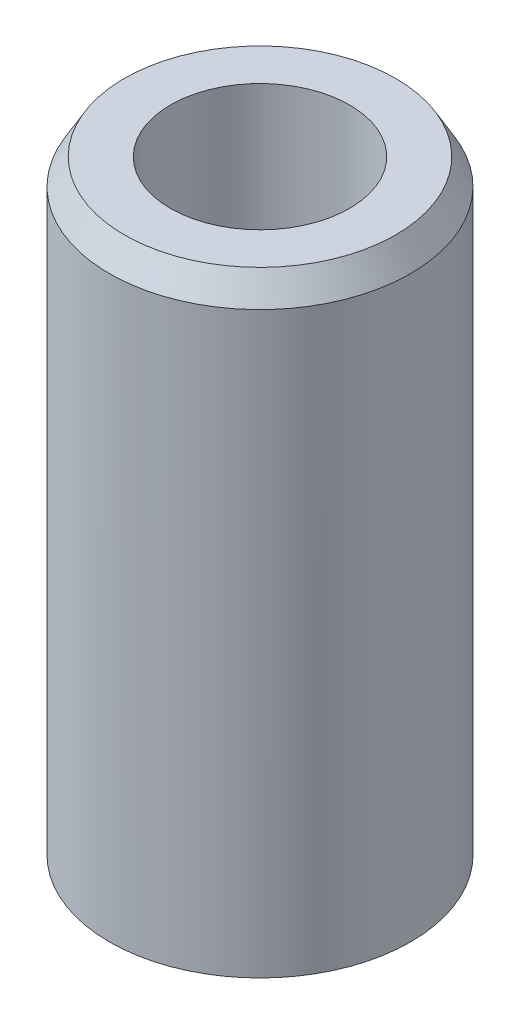
from build123d import *
from OCP.BRepFilletAPI import BRepFilletAPI_MakeChamfer

# Parameters (mm, degrees)
SKETCH1_R           = 22.5
BOSS_EXTRUDE1_DEPTH = 92.588702035
SKETCH2_R           = 13.387813407
CUT_EXTRUDE1_DEPTH  = 98.903869916
CHAMFER1_SIZE       = 3.880772922
CHAMFER1_SIZE2      = 2.240565291


with BuildPart() as part:
    # Sketch1 → Boss-Extrude1 (new body)
    with BuildSketch(Plane(origin=(0, 0, 0), x_dir=(1, 0, 0), z_dir=(0, 1, 0))):
        Circle(SKETCH1_R)
    extrude(amount=BOSS_EXTRUDE1_DEPTH)

    # Sketch2 → Cut-Extrude1 (cut, through all)
    with BuildSketch(Plane(origin=(0, 0, 0), x_dir=(1, 0, 0), z_dir=(0, 1, 0))):
        Circle(SKETCH2_R)
    extrude(amount=CUT_EXTRUDE1_DEPTH, mode=Mode.SUBTRACT)

    # Chamfer1: one chamfer whose edges measure the first distance from different faces: ONE call of the kernel's chamfer builder (chamfer() names one face for all edges)
    chamfer1_edges_1 = [part.edges().sort_by_distance(p)[0] for p in [
        (-22.5, 92.588702035, 0),
    ]]
    chamfer1_side_1 = [part.faces().sort_by_distance(p)[0] for p in [
        (-22.5, 46.294351017, 0),
    ]]
    chamfer1_edges_2 = [part.edges().sort_by_distance(p)[0] for p in [
        (-22.5, 0, 0),
    ]]
    chamfer1_side_2 = [part.faces().sort_by_distance(p)[0] for p in [
        (-21.863603897, 0, 0),
    ]]
    chamfer1 = BRepFilletAPI_MakeChamfer(part.part.solid().wrapped)
    for e in chamfer1_edges_1:
        chamfer1.Add(CHAMFER1_SIZE, CHAMFER1_SIZE2, e.wrapped, chamfer1_side_1[0].wrapped)  # the first distance lies on this face
    for e in chamfer1_edges_2:
        chamfer1.Add(CHAMFER1_SIZE, CHAMFER1_SIZE2, e.wrapped, chamfer1_side_2[0].wrapped)  # the first distance lies on this face
    add(Compound.cast(chamfer1.Shape()), mode=Mode.REPLACE)


solid = part.part
